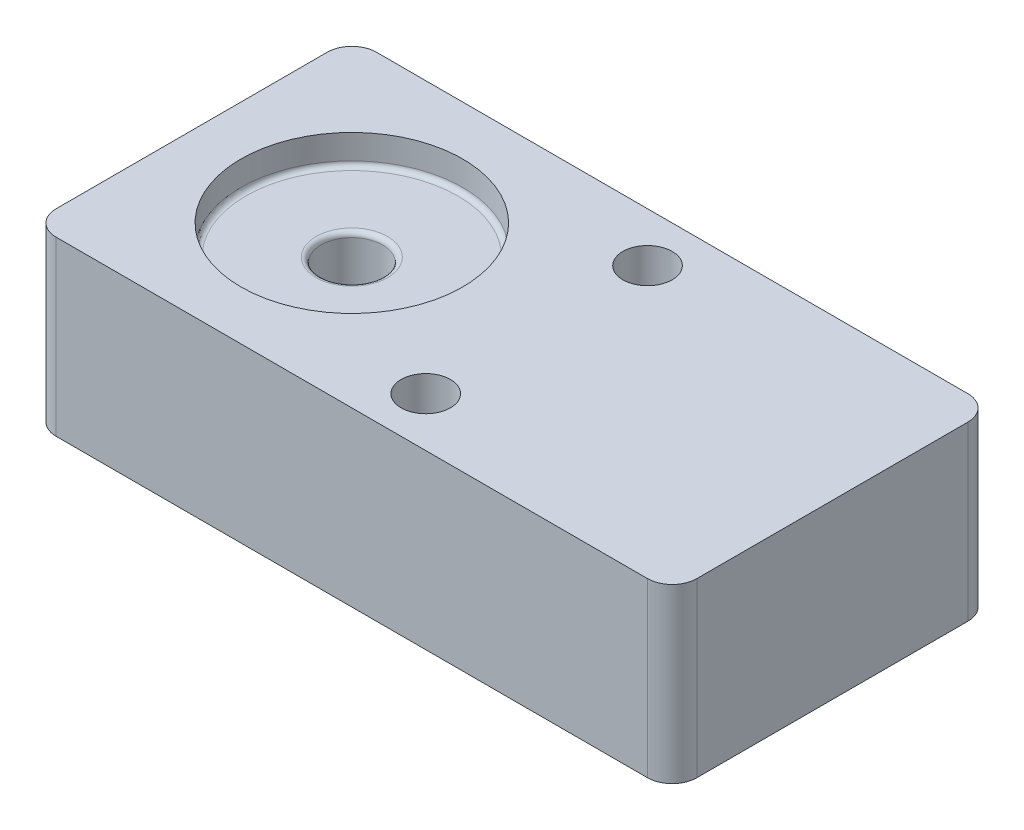
from build123d import *

# Parameters (mm, degrees)
ESQUISSE2_W             = 260
ESQUISSE2_H             = 130
BOSS_EXTRU_2_DEPTH      = 70
ESQUISSE3_R             = 45
ENL_V_MAT_EXTRU_1_DEPTH = 12
CONG_1_R                = 2
ESQUISSE4_R             = 12.5
ENL_V_MAT_EXTRU_2_DEPTH = 38
CONG_2_R                = 2
CONG_3_R                = 2
CONG_4_R                = 10
CONG_5_R                = 10
CONG_6_R                = 10
CONG_7_R                = 10
ESQUISSE6_R             = 10
ENL_V_MAT_EXTRU_3_DEPTH = 162.322658049


with BuildPart() as part:
    # Esquisse2 → Boss.-Extru.2 (new body)
    with BuildSketch(Plane(origin=(0, 0, 0), x_dir=(1, 0, 0), z_dir=(0, 1, 0))):
        Rectangle(ESQUISSE2_W, ESQUISSE2_H)
    extrude(amount=BOSS_EXTRU_2_DEPTH)

    # Esquisse3 → Enlèv. mat.-Extru.1 (cut)
    with BuildSketch(Plane(origin=(0, 70, 0), x_dir=(1, 0, 0), z_dir=(0, 1, 0))):
        with Locations((-65, 0)):
            Circle(ESQUISSE3_R)
    extrude(amount=-ENL_V_MAT_EXTRU_1_DEPTH, mode=Mode.SUBTRACT)

    # Congé1
    cong_1_edges = [part.edges().sort_by_distance(p)[0] for p in [
        (-110, 58, 0),
    ]]
    fillet(cong_1_edges, radius=CONG_1_R)

    # Esquisse4 → Enlèv. mat.-Extru.2 (cut)
    with BuildSketch(Plane(origin=(0, 58, 0), x_dir=(1, 0, 0), z_dir=(0, 1, 0))):
        with Locations((-65, 0)):
            Circle(ESQUISSE4_R)
    extrude(amount=-ENL_V_MAT_EXTRU_2_DEPTH, mode=Mode.SUBTRACT)

    # Congé2
    cong_2_edges = [part.edges().sort_by_distance(p)[0] for p in [
        (-77.5, 58, 0),
    ]]
    fillet(cong_2_edges, radius=CONG_2_R)

    # Congé3
    cong_3_edges = [part.edges().sort_by_distance(p)[0] for p in [
        (-77.5, 20, 0),
    ]]
    fillet(cong_3_edges, radius=CONG_3_R)

    # Congé4
    cong_4_edges = [part.edges().sort_by_distance(p)[0] for p in [
        (-130, 35, -65),
    ]]
    fillet(cong_4_edges, radius=CONG_4_R)

    # Congé5
    cong_5_edges = [part.edges().sort_by_distance(p)[0] for p in [
        (-130, 35, 65),
    ]]
    fillet(cong_5_edges, radius=CONG_5_R)

    # Congé6
    cong_6_edges = [part.edges().sort_by_distance(p)[0] for p in [
        (130, 35, 65),
    ]]
    fillet(cong_6_edges, radius=CONG_6_R)

    # Congé7
    cong_7_edges = [part.edges().sort_by_distance(p)[0] for p in [
        (130, 35, -65),
    ]]
    fillet(cong_7_edges, radius=CONG_7_R)

    # Esquisse6 → Enlèv. mat.-Extru.3 (cut, through all)
    with BuildSketch(Plane(origin=(0, 70, 0), x_dir=(1, 0, 0), z_dir=(0, 1, 0))):
        with Locations((10, 45)):
            Circle(ESQUISSE6_R)
        with Locations((10, -45)):
            Circle(ESQUISSE6_R)
    extrude(amount=-ENL_V_MAT_EXTRU_3_DEPTH, mode=Mode.SUBTRACT)


solid = part.part
